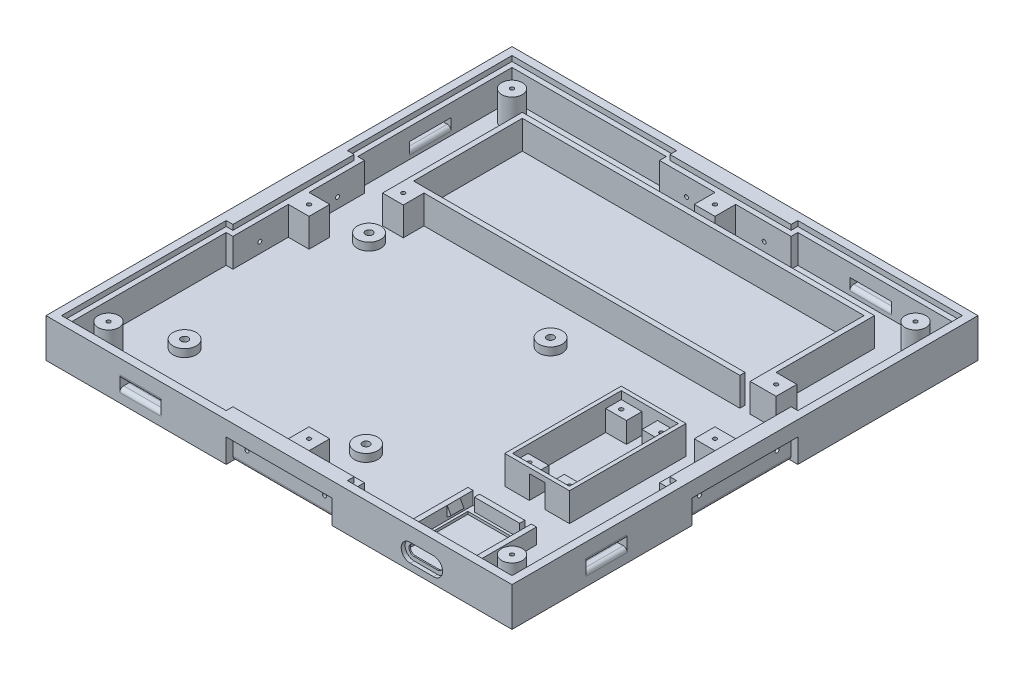
from build123d import *

# Parameters (mm, degrees)
SKETCH1_W              = 180
SKETCH1_H              = 180
SKETCH1_W_2            = 96.073021888
SKETCH1_H_2            = 97.47003078
BOSS_EXTRUDE1_DEPTH    = 10
SKETCH1_3_W            = 96.073021888
SKETCH1_3_H            = 97.47003078
SKETCH1_3_W_2          = 76.073021888
SKETCH1_3_H_2          = 77.47003078
SKETCH1_3_R            = 1.5
SKETCH1_3_R_2          = 4.5
BOSS_EXTRUDE2_DEPTH    = 2
SKETCH4_W              = 40.8
SKETCH4_H              = 9.2
CUT_EXTRUDE3_DEPTH     = 2.6
CIRPATTERN2_COUNT      = 4
CUT_EXTRUDE4_START     = -10
SKETCH5_W              = 87.121526745
SKETCH5_H              = 90.393272249
CUT_EXTRUDE4_DEPTH     = 8
SKETCH6_R              = 0.75
CUT_EXTRUDE5_DEPTH     = 5
CIRPATTERN3_COUNT      = 4
FILLET1_R              = 1.5
CUT_EXTRUDE6_DEPTH     = 2
CUT_EXTRUDE7_START     = -6
SKETCH8_W              = 16
SKETCH8_H              = 3
CUT_EXTRUDE7_DEPTH     = 11
FILLET2_R              = 1.5
CIRPATTERN8_COUNT      = 4
FILLET3_R              = 1.5
SKETCH9_R              = 4.5
SKETCH9_R_2            = 1.375
BOSS_EXTRUDE4_DEPTH    = 3
CUT_EXTRUDE8_START     = -1
SKETCH9_2_R            = 1.375
CUT_EXTRUDE8_DEPTH     = 1
SKETCH10_W             = 20.5
SKETCH10_H             = 2
CUT_EXTRUDE9_DEPTH     = 6.5
BOSS_EXTRUDE6_DEPTH    = 1
BOSS_EXTRUDE7_DEPTH    = 6
SKETCH11_W             = 2.5
SKETCH11_H             = 2
CUT_EXTRUDE10_DEPTH    = 5
CUT_EXTRUDE11_DEPTH    = 200.709789445
CUT_EXTRUDE12_DEPTH    = 1.5
BOSS_EXTRUDE8_START    = -5
BOSS_EXTRUDE8_DEPTH    = 5
BOSS_EXTRUDE9_START    = -29
BOSS_EXTRUDE9_DEPTH    = 3
BOSS_EXTRUDE10_START   = -8
SKETCH2_W              = 8
SKETCH2_H              = 6
SKETCH2_R              = 0.75
BOSS_EXTRUDE10_DEPTH   = 8
BOSS_EXTRUDE10_2_DEPTH = 8
BOSS_EXTRUDE10_3_DEPTH = 8
BOSS_EXTRUDE10_4_DEPTH = 8
BOSS_EXTRUDE11_START   = -8
SKETCH2_3_W            = 25
SKETCH2_3_H            = 45
SKETCH2_3_W_2          = 22
SKETCH2_3_H_2          = 42
BOSS_EXTRUDE11_DEPTH   = 9
SKETCH15_W             = 6
SKETCH15_H             = 1.5
CUT_EXTRUDE13_DEPTH    = 9
SKETCH16_W             = 180
SKETCH16_H             = 180
BOSS_EXTRUDE12_DEPTH   = 5
BOSS_EXTRUDE13_START   = -7
BOSS_EXTRUDE13_DEPTH   = 5
SKETCH18_W             = 136
SKETCH18_H             = 46
SKETCH18_W_2           = 132
SKETCH18_H_2           = 42
BOSS_EXTRUDE14_DEPTH   = 11
SKETCH19_W             = 4
SKETCH19_H             = 2
CUT_EXTRUDE14_DEPTH    = 11
SKETCH20_W             = 8
SKETCH20_H             = 8
SKETCH20_R             = 0.75
SKETCH20_R_2           = 4
BOSS_EXTRUDE15_DEPTH   = 11
BOSS_EXTRUDE16_START   = 1
SKETCH2_4_W            = 25
SKETCH2_4_H            = 45
SKETCH2_4_W_2          = 22
SKETCH2_4_H_2          = 42
BOSS_EXTRUDE16_DEPTH   = 2


with BuildPart() as part:
    # Sketch1 → Boss-Extrude1 (new body)
    with BuildSketch(Plane(origin=(0, 0, 0), x_dir=(1, 0, 0), z_dir=(0, 1, 0))):
        Rectangle(SKETCH1_W, SKETCH1_H)
        Rectangle(SKETCH1_W_2, SKETCH1_H_2, mode=Mode.SUBTRACT)
    extrude(amount=BOSS_EXTRUDE1_DEPTH)

    # Sketch1<3> → Boss-Extrude2 (add)
    # profile 1 of 6: a face of its own
    with BuildSketch(Plane(origin=(0, 0, 0), x_dir=(1, 0, 0), z_dir=(0, 1, 0))):
        Rectangle(SKETCH1_3_W, SKETCH1_3_H)
        Rectangle(SKETCH1_3_W_2, SKETCH1_3_H_2, mode=Mode.SUBTRACT)
    # profile 2 of 6: a face of its own
    with BuildSketch(Plane(origin=(0, 0, 0), x_dir=(1, 0, 0), z_dir=(0, 1, 0))):
        Rectangle(SKETCH1_3_W_2, SKETCH1_3_H_2)
        with Locations((34.990916942, 35.687000466)):
            Circle(SKETCH1_3_R, mode=Mode.SUBTRACT)
        with Locations((-35.115505573, 35.687000466)):
            Circle(SKETCH1_3_R, mode=Mode.SUBTRACT)
        with Locations((34.990916942, -35.558880992)):
            Circle(SKETCH1_3_R, mode=Mode.SUBTRACT)
        with Locations((-35.115505573, -35.558880992)):
            Circle(SKETCH1_3_R, mode=Mode.SUBTRACT)
    # profile 3 of 6: a face of its own
    with BuildSketch(Plane(origin=(0, 0, 0), x_dir=(1, 0, 0), z_dir=(0, 1, 0))):
        with Locations((-35.115505573, 35.687000466)):
            Circle(SKETCH1_3_R_2)
    # profile 4 of 6: a face of its own
    with BuildSketch(Plane(origin=(0, 0, 0), x_dir=(1, 0, 0), z_dir=(0, 1, 0))):
        with Locations((34.990916942, 35.687000466)):
            Circle(SKETCH1_3_R_2)
    # profile 5 of 6: a face of its own
    with BuildSketch(Plane(origin=(0, 0, 0), x_dir=(1, 0, 0), z_dir=(0, 1, 0))):
        with Locations((34.990916942, -35.558880992)):
            Circle(SKETCH1_3_R_2)
    # profile 6 of 6: a face of its own
    with BuildSketch(Plane(origin=(0, 0, 0), x_dir=(1, 0, 0), z_dir=(0, 1, 0))):
        with Locations((-35.115505573, -35.558880992)):
            Circle(SKETCH1_3_R_2)
    extrude(amount=BOSS_EXTRUDE2_DEPTH)

    # Sketch4 → Cut-Extrude3 (cut)
    with BuildSketch(Plane(origin=(0, 0, -90), x_dir=(-1, 0, 0), z_dir=(0, 0, -1))):
        with Locations((0, 4.6)):
            Rectangle(SKETCH4_W, SKETCH4_H)
    cut_extrude3 = extrude(amount=-CUT_EXTRUDE3_DEPTH, mode=Mode.SUBTRACT)

    # CirPattern2: Cut-Extrude3 ×4 about axis
    cirpattern2_axis = Axis((0, 0, 0), (0, 1, 0))
    for i in range(1, CIRPATTERN2_COUNT):
        add(cut_extrude3.rotate(cirpattern2_axis, i * 360 / CIRPATTERN2_COUNT), mode=Mode.SUBTRACT)

    # Sketch5 → Cut-Extrude4 (cut)
    with BuildSketch(Plane.XZ.offset(CUT_EXTRUDE4_START)):
        Polygon((-82.4, -25.4), (-85, -25.4), (-85, -85), (-25.4, -85), (-25.4, -82.4), (25.4, -82.4), (25.4, -85), (85, -85), (85, -25.4), (82.4, -25.4), (82.4, 25.4), (85, 25.4), (85, 85), (25.4, 85), (25.4, 82.4), (-25.4, 82.4), (-25.4, 85), (-85, 85), (-85, 25.4), (-82.4, 25.4), align=None)
        with Locations((0.31642144, -0.762212496)):
            Rectangle(SKETCH5_W, SKETCH5_H, mode=Mode.SUBTRACT)
    extrude(amount=CUT_EXTRUDE4_DEPTH, mode=Mode.SUBTRACT)

    # Sketch6 → Cut-Extrude5 (cut)
    with BuildSketch(Plane(origin=(0, 0, -87.4), x_dir=(-1, 0, 0), z_dir=(0, 0, -1))):
        with Locations((-15, 6)):
            Circle(SKETCH6_R)
        with Locations((15, 6)):
            Circle(SKETCH6_R)
    cut_extrude5 = extrude(amount=-CUT_EXTRUDE5_DEPTH, mode=Mode.SUBTRACT)

    # CirPattern3: Cut-Extrude5 ×4 about axis
    cirpattern3_axis = Axis((0, 2, 0), (0, 1, 0))
    for i in range(1, CIRPATTERN3_COUNT):
        add(cut_extrude5.rotate(cirpattern3_axis, i * 360 / CIRPATTERN3_COUNT), mode=Mode.SUBTRACT)

    # Fillet1
    fillet1_edges = [part.edges().sort_by_distance(p)[0] for p in [
        (0, 0, -87.4),
        (-87.4, 0, 0),
        (0, 0, 87.4),
        (87.4, 0, 0),
    ]]
    fillet(fillet1_edges, radius=FILLET1_R)

    # Sketch7 → Cut-Extrude6 (cut)
    with BuildSketch(Plane(origin=(0, 10, 0), x_dir=(1, 0, 0), z_dir=(0, 1, 0))):
        Polygon((23.4, -84.4), (23.4, -87), (87, -87), (87, -23.4), (84.4, -23.4), (84.4, 23.4), (87, 23.4), (87, 87), (23.4, 87), (23.4, 84.4), (-23.4, 84.4), (-23.4, 87), (-87, 87), (-87, 23.4), (-84.4, 23.4), (-84.4, -23.4), (-87, -23.4), (-87, -87), (-23.4, -87), (-23.4, -84.4), align=None)
    extrude(amount=-CUT_EXTRUDE6_DEPTH, mode=Mode.SUBTRACT)

    # Sketch8 → Cut-Extrude7 (cut)
    with BuildSketch(Plane.ZY.offset(90).offset(CUT_EXTRUDE7_START)):
        with Locations((-53.5, 6.5)):
            Rectangle(SKETCH8_W, SKETCH8_H)
    cut_extrude7 = extrude(amount=CUT_EXTRUDE7_DEPTH, mode=Mode.SUBTRACT)

    # Fillet2
    fillet2_edges = [part.edges().sort_by_distance(p)[0] for p in [
        (-90, 5, -53.5),
        (-90, 8, -53.5),
    ]]
    fillet(fillet2_edges, radius=FILLET2_R)

    # CirPattern8: Cut-Extrude7 ×4 about axis
    cirpattern8_axis = Axis((0, 0, 0), (0, 1, 0))
    for i in range(1, CIRPATTERN8_COUNT):
        add(cut_extrude7.rotate(cirpattern8_axis, i * 360 / CIRPATTERN8_COUNT), mode=Mode.SUBTRACT)

    # Fillet3
    fillet3_edges = [part.edges().sort_by_distance(p)[0] for p in [
        (-85, 5, -53.5),
        (53.5, 5, -85),
        (85, 5, 53.5),
        (-53.5, 5, 85),
        (-53.5, 5, 90),
        (-53.5, 8, 90),
        (90, 5, 53.5),
        (90, 8, 53.5),
        (53.5, 5, -90),
        (53.5, 8, -90),
    ]]
    fillet(fillet3_edges, radius=FILLET3_R)

    # Sketch9 → Boss-Extrude4 (add)
    # profile 1 of 4: a face of its own
    with BuildSketch(Plane(origin=(0, 2, 0), x_dir=(1, 0, 0), z_dir=(0, 1, 0))):
        with Locations(Location((-65.344243082, 10.128182239, 0), (0, 0, 270))):
            Circle(SKETCH9_R)
        with Locations(Location((-65.344243082, 10.128182239, 0), (0, 0, 270))):
            Circle(SKETCH9_R_2, mode=Mode.SUBTRACT)
    # profile 2 of 4: a face of its own
    with BuildSketch(Plane(origin=(0, 2, 0), x_dir=(1, 0, 0), z_dir=(0, 1, 0))):
        with Locations(Location((4.762179433, 10.128182239, 0), (0, 0, 270))):
            Circle(SKETCH9_R)
        with Locations(Location((4.762179433, 10.128182239, 0), (0, 0, 90))):
            Circle(SKETCH9_R_2, mode=Mode.SUBTRACT)
    # profile 3 of 4: a face of its own
    with BuildSketch(Plane(origin=(0, 2, 0), x_dir=(1, 0, 0), z_dir=(0, 1, 0))):
        with Locations(Location((4.762179433, -61.117699219, 0), (0, 0, 270))):
            Circle(SKETCH9_R)
        with Locations(Location((4.762179433, -61.117699219, 0), (0, 0, 270))):
            Circle(SKETCH9_R_2, mode=Mode.SUBTRACT)
    # profile 4 of 4: a face of its own
    with BuildSketch(Plane(origin=(0, 2, 0), x_dir=(1, 0, 0), z_dir=(0, 1, 0))):
        with Locations(Location((-65.344243082, -61.117699219, 0), (0, 0, 270))):
            Circle(SKETCH9_R)
        with Locations(Location((-65.344243082, -61.117699219, 0), (0, 0, 90))):
            Circle(SKETCH9_R_2, mode=Mode.SUBTRACT)
    extrude(amount=BOSS_EXTRUDE4_DEPTH)

    # Sketch9<2> → Cut-Extrude8 (cut)
    with BuildSketch(Plane(origin=(0, 2, 0), x_dir=(1, 0, 0), z_dir=(0, 1, 0)).offset(CUT_EXTRUDE8_START)):
        with Locations(Location((-65.344243082, -61.117699219, 0), (0, 0, 90))):
            Circle(SKETCH9_2_R)
        with Locations(Location((4.762179433, -61.117699219, 0), (0, 0, 270))):
            Circle(SKETCH9_2_R)
        with Locations(Location((4.762179433, 10.128182239, 0), (0, 0, 90))):
            Circle(SKETCH9_2_R)
        with Locations(Location((-65.344243082, 10.128182239, 0), (0, 0, 270))):
            Circle(SKETCH9_2_R)
    extrude(amount=CUT_EXTRUDE8_DEPTH, mode=Mode.SUBTRACT)

    # Sketch10 → Cut-Extrude9 (cut)
    with BuildSketch(Plane(origin=(0, 2, 0), x_dir=(1, 0, 0), z_dir=(0, 1, 0))):
        with Locations((55.2, -86)):
            Rectangle(SKETCH10_W, SKETCH10_H)
        Polygon((65.45, -87), (44.95, -87), (44.95, -85), (43.95, -85), (43.95, -88), (66.45, -88), (66.45, -85), (65.45, -85), align=None)
    extrude(amount=CUT_EXTRUDE9_DEPTH, mode=Mode.SUBTRACT)

    # Sketch10<3> → Boss-Extrude6 (add)
    with BuildSketch(Plane(origin=(0, 2, 0), x_dir=(1, 0, 0), z_dir=(0, 1, 0))):
        Polygon((43.95, -85), (44.95, -85), (44.95, -62), (65.45, -62), (65.45, -85), (66.45, -85), (66.45, -61), (43.95, -61), align=None)
        Polygon((65.45, -87), (44.95, -87), (44.95, -85), (43.95, -85), (43.95, -88), (66.45, -88), (66.45, -85), (65.45, -85), align=None)
    extrude(amount=BOSS_EXTRUDE6_DEPTH)

    # Sketch10<4> → Boss-Extrude7 (add)
    with BuildSketch(Plane(origin=(0, 2, 0), x_dir=(1, 0, 0), z_dir=(0, 1, 0))):
        Polygon((41.95, -85), (43.95, -85), (43.95, -61), (66.45, -61), (66.45, -85), (68.45, -85), (68.45, -59), (41.95, -59), align=None)
    extrude(amount=BOSS_EXTRUDE7_DEPTH)

    # Sketch11 → Cut-Extrude10 (cut)
    with BuildSketch(Plane(origin=(0, 8, 0), x_dir=(1, 0, 0), z_dir=(0, 1, 0))):
        with Locations((45.2, -60)):
            Rectangle(SKETCH11_W, SKETCH11_H)
        with Locations((65.2, -60)):
            Rectangle(SKETCH11_W, SKETCH11_H)
    extrude(amount=-CUT_EXTRUDE10_DEPTH, mode=Mode.SUBTRACT)

    # Sketch12 → Cut-Extrude11 (cut, through all)
    with BuildSketch(Plane(origin=(0, 0, 88), x_dir=(-1, 0, 0), z_dir=(0, 0, -1))):
        with BuildLine():
            Line((-59.7, 8), (-50.7, 8))
            ThreePointArc((-50.7, 8), (-48.7, 6), (-50.7, 4))
            Line((-50.7, 4), (-59.7, 4))
            ThreePointArc((-59.7, 4), (-61.7, 6), (-59.7, 8))
        make_face()
    extrude(amount=-CUT_EXTRUDE11_DEPTH, mode=Mode.SUBTRACT)

    # Sketch13 → Cut-Extrude12 (cut)
    with BuildSketch(Plane.XY.offset(90)):
        with BuildLine():
            Line((50.7, 2.5), (59.7, 2.5))
            ThreePointArc((59.7, 2.5), (63.2, 6), (59.7, 9.5))
            Line((59.7, 9.5), (50.7, 9.5))
            ThreePointArc((50.7, 9.5), (47.2, 6), (50.7, 2.5))
        make_face()
    extrude(amount=-CUT_EXTRUDE12_DEPTH, mode=Mode.SUBTRACT)

    # Sketch14 → Boss-Extrude8 (add)
    with BuildSketch(Plane(origin=(0, 0, 59), x_dir=(-1, 0, 0), z_dir=(0, 0, -1)).offset(BOSS_EXTRUDE8_START)):
        Polygon((-43.95, 4), (-45.45, 5.267829755), (-43.95, 8), align=None)
    boss_extrude8 = extrude(amount=-BOSS_EXTRUDE8_DEPTH)

    # Sketch14<2> → Boss-Extrude9 (add)
    with BuildSketch(Plane(origin=(0, 0, 59), x_dir=(-1, 0, 0), z_dir=(0, 0, -1)).offset(BOSS_EXTRUDE9_START)):
        Polygon((-43.95, 4), (-45.45, 5.267829755), (-43.95, 8), align=None)
    boss_extrude9 = extrude(amount=BOSS_EXTRUDE9_DEPTH)

    # Mirror1: Boss-Extrude8, Boss-Extrude9 across plane
    add(boss_extrude8.mirror(Plane(origin=(55.2, 0, 0), x_dir=(0, 0, 1), z_dir=(1, 0, 0))))
    add(boss_extrude9.mirror(Plane(origin=(55.2, 0, 0), x_dir=(0, 0, 1), z_dir=(1, 0, 0))))



with BuildPart() as body_2:
    # Sketch2 → Boss-Extrude10 (new body)
    with BuildSketch(Plane(origin=(0, 10, 0), x_dir=(1, 0, 0), z_dir=(0, 1, 0)).offset(BOSS_EXTRUDE10_START)):
        with Locations((48.2, -41)):
            Rectangle(SKETCH2_W, SKETCH2_H)
        with Locations(Location((47.45, -40.75, 0), (0, 0, 270))):
            Circle(SKETCH2_R, mode=Mode.SUBTRACT)
    extrude(amount=BOSS_EXTRUDE10_DEPTH)


with BuildPart() as body_3:
    # Sketch2 → Boss-Extrude10 2 (new body)
    with BuildSketch(Plane(origin=(0, 10, 0), x_dir=(1, 0, 0), z_dir=(0, 1, 0)).offset(BOSS_EXTRUDE10_START)):
        with Locations((62.2, -41)):
            Rectangle(SKETCH2_W, SKETCH2_H)
        with Locations(Location((62.95, -40.75, 0), (0, 0, 270))):
            Circle(SKETCH2_R, mode=Mode.SUBTRACT)
    extrude(amount=BOSS_EXTRUDE10_2_DEPTH)


with BuildPart() as body_4:
    # Sketch2 → Boss-Extrude10 3 (new body)
    with BuildSketch(Plane(origin=(0, 10, 0), x_dir=(1, 0, 0), z_dir=(0, 1, 0)).offset(BOSS_EXTRUDE10_START)):
        with Locations((62.2, -5)):
            Rectangle(SKETCH2_W, SKETCH2_H)
        with Locations(Location((62.95, -5.25, 0), (0, 0, 270))):
            Circle(SKETCH2_R, mode=Mode.SUBTRACT)
    extrude(amount=BOSS_EXTRUDE10_3_DEPTH)


with BuildPart() as body_5:
    # Sketch2 → Boss-Extrude10 4 (new body)
    with BuildSketch(Plane(origin=(0, 10, 0), x_dir=(1, 0, 0), z_dir=(0, 1, 0)).offset(BOSS_EXTRUDE10_START)):
        with Locations((48.2, -5)):
            Rectangle(SKETCH2_W, SKETCH2_H)
        with Locations(Location((47.45, -5.25, 0), (0, 0, 270))):
            Circle(SKETCH2_R, mode=Mode.SUBTRACT)
    extrude(amount=BOSS_EXTRUDE10_4_DEPTH)


with BuildPart() as part_1:
    add(part.part)

    add(body_2.part)  # Boss-Extrude11 merges body 2

    add(body_3.part)  # Boss-Extrude11 merges body 3

    add(body_4.part)  # Boss-Extrude11 merges body 4

    add(body_5.part)  # Boss-Extrude11 merges body 5
    # Sketch2<3> → Boss-Extrude11 (add)
    with BuildSketch(Plane(origin=(0, 10, 0), x_dir=(1, 0, 0), z_dir=(0, 1, 0)).offset(BOSS_EXTRUDE11_START)):
        with Locations((55.2, -23)):
            Rectangle(SKETCH2_3_W, SKETCH2_3_H)
        with Locations((55.2, -23)):
            Rectangle(SKETCH2_3_W_2, SKETCH2_3_H_2, mode=Mode.SUBTRACT)
    extrude(amount=BOSS_EXTRUDE11_DEPTH)

    # Sketch15 → Cut-Extrude13 (cut)
    with BuildSketch(Plane(origin=(0, 11, 0), x_dir=(1, 0, 0), z_dir=(0, 1, 0))):
        with Locations((55.2, -44.75)):
            Rectangle(SKETCH15_W, SKETCH15_H)
    extrude(amount=-CUT_EXTRUDE13_DEPTH, mode=Mode.SUBTRACT)

    # Sketch16 → Boss-Extrude12 (add)
    with BuildSketch(Plane(origin=(0, 10, 0), x_dir=(1, 0, 0), z_dir=(0, 1, 0))):
        Rectangle(SKETCH16_W, SKETCH16_H)
        Polygon((-23.4, -84.4), (23.4, -84.4), (23.4, -87), (87, -87), (87, -23.4), (84.4, -23.4), (84.4, 23.4), (87, 23.4), (87, 87), (23.4, 87), (23.4, 84.4), (-23.4, 84.4), (-23.4, 87), (-87, 87), (-87, 23.4), (-84.4, 23.4), (-84.4, -23.4), (-87, -23.4), (-87, -87), (-23.4, -87), align=None, mode=Mode.SUBTRACT)
    extrude(amount=BOSS_EXTRUDE12_DEPTH)

    # Sketch17 → Boss-Extrude13 (add)
    with BuildSketch(Plane(origin=(0, 15, 0), x_dir=(1, 0, 0), z_dir=(0, 1, 0)).offset(BOSS_EXTRUDE13_START)):
        Polygon((23.4, -87), (87, -87), (87, -23.4), (84.4, -23.4), (84.4, 23.4), (87, 23.4), (87, 87), (23.4, 87), (23.4, 84.4), (-23.4, 84.4), (-23.4, 87), (-87, 87), (-87, 23.4), (-84.4, 23.4), (-84.4, -23.4), (-87, -23.4), (-87, -87), (-23.4, -87), (-23.4, -84.4), (23.4, -84.4), align=None)
        Polygon((25.4, -85), (85, -85), (85, -25.4), (82.4, -25.4), (82.4, 25.4), (85, 25.4), (85, 85), (25.4, 85), (25.4, 82.4), (-25.4, 82.4), (-25.4, 85), (-85, 85), (-85, 25.4), (-82.4, 25.4), (-82.4, -25.4), (-85, -25.4), (-85, -85), (-25.4, -85), (-25.4, -82.4), (25.4, -82.4), align=None, mode=Mode.SUBTRACT)
    extrude(amount=BOSS_EXTRUDE13_DEPTH)

    # Sketch18 → Boss-Extrude14 (add)
    with BuildSketch(Plane(origin=(0, 2, 0), x_dir=(1, 0, 0), z_dir=(0, 1, 0))):
        with Locations((0, 49)):
            Rectangle(SKETCH18_W, SKETCH18_H)
        with Locations((0, 49)):
            Rectangle(SKETCH18_W_2, SKETCH18_H_2, mode=Mode.SUBTRACT)
    extrude(amount=BOSS_EXTRUDE14_DEPTH)

    # Sketch19 → Cut-Extrude14 (cut)
    with BuildSketch(Plane(origin=(0, 13, 0), x_dir=(1, 0, 0), z_dir=(0, 1, 0))):
        with Locations((64, 27)):
            Rectangle(SKETCH19_W, SKETCH19_H)
    extrude(amount=-CUT_EXTRUDE14_DEPTH, mode=Mode.SUBTRACT)

    # Sketch20 → Boss-Extrude15 (add)
    # profile 1 of 10: a face of its own
    with BuildSketch(Plane(origin=(0, 2, 0), x_dir=(1, 0, 0), z_dir=(0, 1, 0))):
        with Locations((-78.4, 0)):
            Rectangle(SKETCH20_W, SKETCH20_H)
        with Locations(Location((-78.4, 0, 0), (0, 0, 270))):
            Circle(SKETCH20_R, mode=Mode.SUBTRACT)
    # profile 2 of 10: a face of its own
    with BuildSketch(Plane(origin=(0, 2, 0), x_dir=(1, 0, 0), z_dir=(0, 1, 0))):
        with Locations((-64, 22)):
            Rectangle(SKETCH20_W, SKETCH20_H)
        with Locations(Location((-64, 22, 0), (0, 0, 270))):
            Circle(SKETCH20_R, mode=Mode.SUBTRACT)
    # profile 3 of 10: a face of its own
    with BuildSketch(Plane(origin=(0, 2, 0), x_dir=(1, 0, 0), z_dir=(0, 1, 0))):
        with Locations(Location((-77.928932188, 77.928932188, 0), (0, 0, 270))):
            Circle(SKETCH20_R_2)
        with Locations(Location((-77.928932188, 77.928932188, 0), (0, 0, 270))):
            Circle(SKETCH20_R, mode=Mode.SUBTRACT)
    # profile 4 of 10: a face of its own
    with BuildSketch(Plane(origin=(0, 2, 0), x_dir=(1, 0, 0), z_dir=(0, 1, 0))):
        with Locations((0, 78.4)):
            Rectangle(SKETCH20_W, SKETCH20_H)
        with Locations(Location((0, 78.4, 0), (0, 0, 270))):
            Circle(SKETCH20_R, mode=Mode.SUBTRACT)
    # profile 5 of 10: a face of its own
    with BuildSketch(Plane(origin=(0, 2, 0), x_dir=(1, 0, 0), z_dir=(0, 1, 0))):
        with Locations(Location((77.928932188, 77.928932188, 0), (0, 0, 270))):
            Circle(SKETCH20_R_2)
        with Locations(Location((77.928932188, 77.928932188, 0), (0, 0, 270))):
            Circle(SKETCH20_R, mode=Mode.SUBTRACT)
    # profile 6 of 10: a face of its own
    with BuildSketch(Plane(origin=(0, 2, 0), x_dir=(1, 0, 0), z_dir=(0, 1, 0))):
        with Locations((72, 30)):
            Rectangle(SKETCH20_W, SKETCH20_H)
        with Locations(Location((72, 30, 0), (0, 0, 270))):
            Circle(SKETCH20_R, mode=Mode.SUBTRACT)
    # profile 7 of 10: a face of its own
    with BuildSketch(Plane(origin=(0, 2, 0), x_dir=(1, 0, 0), z_dir=(0, 1, 0))):
        with Locations((78.4, 0)):
            Rectangle(SKETCH20_W, SKETCH20_H)
        with Locations(Location((78.4, 0, 0), (0, 0, 270))):
            Circle(SKETCH20_R, mode=Mode.SUBTRACT)
    # profile 8 of 10: a face of its own
    with BuildSketch(Plane(origin=(0, 2, 0), x_dir=(1, 0, 0), z_dir=(0, 1, 0))):
        with Locations(Location((77.928932188, -77.928932188, 0), (0, 0, 270))):
            Circle(SKETCH20_R_2)
        with Locations(Location((77.928932188, -77.928932188, 0), (0, 0, 270))):
            Circle(SKETCH20_R, mode=Mode.SUBTRACT)
    # profile 9 of 10: a face of its own
    with BuildSketch(Plane(origin=(0, 2, 0), x_dir=(1, 0, 0), z_dir=(0, 1, 0))):
        with Locations((0, -78.4)):
            Rectangle(SKETCH20_W, SKETCH20_H)
        with Locations(Location((0, -78.4, 0), (0, 0, 270))):
            Circle(SKETCH20_R, mode=Mode.SUBTRACT)
    # profile 10 of 10: a face of its own
    with BuildSketch(Plane(origin=(0, 2, 0), x_dir=(1, 0, 0), z_dir=(0, 1, 0))):
        with Locations(Location((-77.928932188, -77.928932188, 0), (0, 0, 270))):
            Circle(SKETCH20_R_2)
        with Locations(Location((-77.928932188, -77.928932188, 0), (0, 0, 270))):
            Circle(SKETCH20_R, mode=Mode.SUBTRACT)
    extrude(amount=BOSS_EXTRUDE15_DEPTH)

    # Sketch2<4> → Boss-Extrude16 (add)
    with BuildSketch(Plane(origin=(0, 10, 0), x_dir=(1, 0, 0), z_dir=(0, 1, 0)).offset(BOSS_EXTRUDE16_START)):
        with Locations((55.2, -23)):
            Rectangle(SKETCH2_4_W, SKETCH2_4_H)
        with Locations((55.2, -23)):
            Rectangle(SKETCH2_4_W_2, SKETCH2_4_H_2, mode=Mode.SUBTRACT)
    extrude(amount=BOSS_EXTRUDE16_DEPTH)


solid = part_1.part
